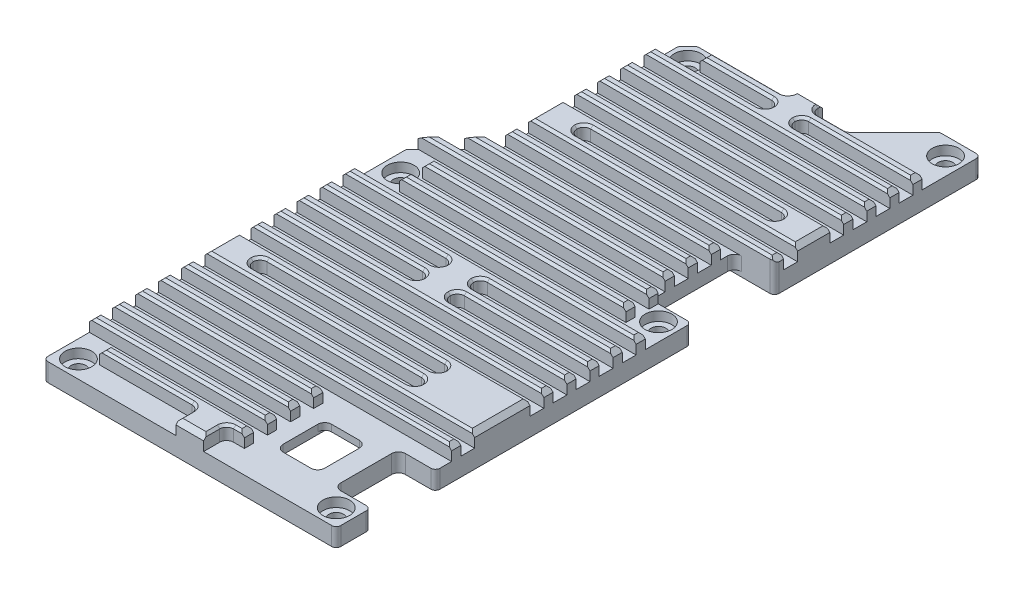
from build123d import *

# Parameters (mm, degrees)
BOSS_EXTRUDE1_DEPTH        = 6.95
CUT_EXTRUDE4_DEPTH         = 1
CUT_EXTRUDE5_DEPTH         = 2
CUT_EXTRUDE6_DEPTH         = 1.2
CUT_EXTRUDE7_DEPTH         = 2
CUT_EXTRUDE8_DEPTH         = 154.611986837
SKETCH15_W                 = 63.5
SKETCH15_H                 = 3
CUT_EXTRUDE9_DEPTH         = 3
LPATTERN1_COUNT            = 28
LPATTERN1_PITCH            = 5
SKETCH16_W                 = 19.671320344
SKETCH16_H                 = 10.16
SKETCH16_W_2               = 7.2
SKETCH16_H_2               = 7
SKETCH16_H_3               = 7.54
CUT_EXTRUDE10_DEPTH        = 3
F_3_2_3_2_DIAMETER_HOLE1_D = 3.2
SKETCH19_R                 = 2.9
CUT_EXTRUDE11_DEPTH        = 2
SKETCH20_W                 = 6
SKETCH20_H                 = 7
SKETCH20_W_2               = 5
SKETCH20_H_2               = 7.54
SKETCH20_W_3               = 7
SKETCH20_W_4               = 15
SKETCH20_H_3               = 12
SKETCH20_H_4               = 8
BOSS_EXTRUDE2_DEPTH        = 3
FILLET1_R                  = 1.5
CUT_EXTRUDE12_DEPTH        = 3
CUT_EXTRUDE13_DEPTH        = 2.5
CUT_EXTRUDE14_DEPTH        = 2.5
CUT_EXTRUDE15_DEPTH        = 3.5
BOSS_EXTRUDE3_DEPTH        = 0.5
CHAMFER1_SIZE              = 0.5
CHAMFER2_SIZE              = 1
CUT_EXTRUDE16_DEPTH        = 2
M3_TAPPED_HOLE1_D          = 2.5
M3_TAPPED_HOLE1_DEPTH      = 6
M3_TAPPED_HOLE1_TIP        = 0.751075774


with BuildPart() as part:
    # Sketch1 → Boss-Extrude1 (new body)
    with BuildSketch(Plane(origin=(0, 0, 0), x_dir=(1, 0, 0), z_dir=(0, 1, 0))):
        with BuildLine():
            Line((0, 1), (0, 78.325786438))
            ThreePointArc((0, 78.325786438), (0.076120467, 78.70846987), (0.292893219, 79.032893219))
            Line((0.292893219, 79.032893219), (9.720660172, 88.460660172))
            ThreePointArc((9.720660172, 88.460660172), (10.045819299, 88.947295195), (10.16, 89.521320344))
            Line((10.16, 89.521320344), (10.16, 127.095786438))
            ThreePointArc((10.16, 127.095786438), (10.236120467, 127.47846987), (10.452893219, 127.802893219))
            Line((10.452893219, 127.802893219), (11.897106781, 129.247106781))
            ThreePointArc((11.897106781, 129.247106781), (12.22153013, 129.463879533), (12.604213562, 129.54))
            Line((12.604213562, 129.54), (43.828679656, 129.54))
            ThreePointArc((43.828679656, 129.54), (44.402704805, 129.654180701), (44.889339828, 129.979339828))
            Line((44.889339828, 129.979339828), (54.317106781, 139.407106781))
            ThreePointArc((54.317106781, 139.407106781), (54.64153013, 139.623879533), (55.024213562, 139.7))
            Line((55.024213562, 139.7), (62.5, 139.7))
            ThreePointArc((62.5, 139.7), (63.207106781, 139.407106781), (63.5, 138.7))
            Line((63.5, 138.7), (63.5, 96))
            ThreePointArc((63.5, 96), (63.207106781, 95.292893219), (62.5, 95))
            Line((62.5, 95), (56.3, 95))
            ThreePointArc((56.3, 95), (55.239339828, 94.560660172), (54.8, 93.5))
            Line((54.8, 93.5), (54.8, 78.5))
            ThreePointArc((54.8, 78.5), (55.239339828, 77.439339828), (56.3, 77))
            Line((56.3, 77), (62.5, 77))
            ThreePointArc((62.5, 77), (63.207106781, 76.707106781), (63.5, 76))
            Line((63.5, 76), (63.5, 22.5))
            ThreePointArc((63.5, 22.5), (63.207106781, 21.792893219), (62.5, 21.5))
            Line((62.5, 21.5), (57, 21.5))
            ThreePointArc((57, 21.5), (55.939339828, 21.060660172), (55.5, 20))
            Line((55.5, 20), (55.5, 9))
            ThreePointArc((55.5, 9), (55.939339828, 7.939339828), (57, 7.5))
            Line((57, 7.5), (62.5, 7.5))
            ThreePointArc((62.5, 7.5), (63.207106781, 7.207106781), (63.5, 6.5))
            Line((63.5, 6.5), (63.5, 1))
            ThreePointArc((63.5, 1), (63.207106781, 0.292893219), (62.5, 0))
            Line((62.5, 0), (1, 0))
            ThreePointArc((1, 0), (0.292893219, 0.292893219), (0, 1))
        make_face()
    extrude(amount=BOSS_EXTRUDE1_DEPTH)

    # Sketch2 → Cut-Extrude4 (cut)
    with BuildSketch(Plane(origin=(0, 0, 0), x_dir=(1, 0, 0), z_dir=(0, 1, 0))):
        with BuildLine():
            Line((46.26, 113.15), (33.01, 113.15))
            ThreePointArc((33.01, 113.15), (31.949339828, 112.710660172), (31.51, 111.65))
            Line((31.51, 111.65), (31.51, 99.65))
            ThreePointArc((31.51, 99.65), (31.070660172, 98.589339828), (30.01, 98.15))
            Line((30.01, 98.15), (19.51, 98.15))
            ThreePointArc((19.51, 98.15), (18.449339828, 98.589339828), (18.01, 99.65))
            Line((18.01, 99.65), (18.01, 121.15))
            ThreePointArc((18.01, 121.15), (18.449339828, 122.210660172), (19.51, 122.65))
            Line((19.51, 122.65), (56.01, 122.65))
            ThreePointArc((56.01, 122.65), (57.070660172, 122.210660172), (57.51, 121.15))
            Line((57.51, 121.15), (57.51, 109.65))
            ThreePointArc((57.51, 109.65), (57.070660172, 108.589339828), (56.01, 108.15))
            Line((56.01, 108.15), (49.51, 108.15))
            ThreePointArc((49.51, 108.15), (48.449339828, 108.589339828), (48.01, 109.65))
            Line((48.01, 109.65), (48.01, 111.4))
            ThreePointArc((48.01, 111.4), (47.497436867, 112.637436867), (46.26, 113.15))
        make_face()
        with BuildLine():
            Line((43.76, 109.25), (39.26, 109.25))
            ThreePointArc((39.26, 109.25), (38.199339828, 108.810660172), (37.76, 107.75))
            Line((37.76, 107.75), (37.76, 94))
            ThreePointArc((37.76, 94), (37.320660172, 92.939339828), (36.26, 92.5))
            ThreePointArc((36.26, 92.5), (35.199339828, 92.060660172), (34.76, 91))
            Line((34.76, 91), (34.76, 71.5))
            ThreePointArc((34.76, 71.5), (35.199339828, 70.439339828), (36.26, 70))
            Line((36.26, 70), (53.76, 70))
            ThreePointArc((53.76, 70), (54.820660172, 70.439339828), (55.26, 71.5))
            Line((55.26, 71.5), (55.26, 75.5))
            ThreePointArc((55.26, 75.5), (55.699339828, 76.560660172), (56.76, 77))
            Line((56.76, 77), (62.5, 77))
            Line((62.5, 77), (62.5, 95))
            Line((62.5, 95), (46.76, 95))
            ThreePointArc((46.76, 95), (45.699339828, 95.439339828), (45.26, 96.5))
            Line((45.26, 96.5), (45.26, 107.75))
            ThreePointArc((45.26, 107.75), (44.820660172, 108.810660172), (43.76, 109.25))
        make_face()
        with BuildLine():
            ThreePointArc((23.76, 42.1), (22.345786438, 41.514213562), (21.76, 40.1))
            Line((21.76, 40.1), (21.76, 29.35))
            ThreePointArc((21.76, 29.35), (22.345786438, 27.935786438), (23.76, 27.35))
            Line((23.76, 27.35), (28.76, 27.35))
            ThreePointArc((28.76, 27.35), (30.174213562, 27.935786438), (30.76, 29.35))
            Line((30.76, 29.35), (30.76, 40.1))
            ThreePointArc((30.76, 40.1), (30.174213562, 41.514213562), (28.76, 42.1))
            Line((28.76, 42.1), (23.76, 42.1))
        make_face()
    extrude(amount=CUT_EXTRUDE4_DEPTH, mode=Mode.SUBTRACT)

    # Sketch11 → Cut-Extrude5 (cut)
    with BuildSketch(Plane(origin=(0, 0, 0), x_dir=(1, 0, 0), z_dir=(0, 1, 0))):
        with BuildLine():
            Line((18.76, 92.25), (30.26, 92.25))
            ThreePointArc((30.26, 92.25), (31.320660172, 91.810660172), (31.76, 90.75))
            Line((31.76, 90.75), (31.76, 68.495584412))
            ThreePointArc((31.76, 68.495584412), (31.622983159, 67.806754234), (31.232792206, 67.222792206))
            Line((31.232792206, 67.222792206), (28.787207794, 64.777207794))
            ThreePointArc((28.787207794, 64.777207794), (28.397016841, 64.193245766), (28.26, 63.504415588))
            Line((28.26, 63.504415588), (28.26, 53.495584412))
            ThreePointArc((28.26, 53.495584412), (28.122983159, 52.806754234), (27.732792206, 52.222792206))
            Line((27.732792206, 52.222792206), (20.537207794, 45.027207794))
            ThreePointArc((20.537207794, 45.027207794), (20.147016841, 44.443245766), (20.01, 43.754415588))
            Line((20.01, 43.754415588), (20.01, 26))
            ThreePointArc((20.01, 26), (20.449339828, 24.939339828), (21.51, 24.5))
            Line((21.51, 24.5), (49.76, 24.5))
            ThreePointArc((49.76, 24.5), (50.820660172, 24.060660172), (51.26, 23))
            Line((51.26, 23), (51.26, 6))
            ThreePointArc((51.26, 6), (50.820660172, 4.939339828), (49.76, 4.5))
            Line((49.76, 4.5), (43.26, 4.5))
            ThreePointArc((43.26, 4.5), (42.199339828, 4.939339828), (41.76, 6))
            Line((41.76, 6), (41.76, 6.74))
            ThreePointArc((41.76, 6.74), (41.537401154, 7.277401154), (41, 7.5))
            Line((41, 7.5), (19.505584412, 7.5))
            ThreePointArc((19.505584412, 7.5), (18.816754234, 7.637016841), (18.232792206, 8.027207794))
            Line((18.232792206, 8.027207794), (9.787207794, 16.472792206))
            ThreePointArc((9.787207794, 16.472792206), (9.397016841, 17.056754234), (9.26, 17.745584412))
            Line((9.26, 17.745584412), (9.26, 40.004415588))
            ThreePointArc((9.26, 40.004415588), (9.122983159, 40.693245766), (8.732792206, 41.277207794))
            Line((8.732792206, 41.277207794), (3.537207794, 46.472792206))
            ThreePointArc((3.537207794, 46.472792206), (3.147016841, 47.056754234), (3.01, 47.745584412))
            Line((3.01, 47.745584412), (3.01, 67.5))
            ThreePointArc((3.01, 67.5), (3.449339828, 68.560660172), (4.51, 69))
            Line((4.51, 69), (15.76, 69))
            ThreePointArc((15.76, 69), (16.820660172, 69.439339828), (17.26, 70.5))
            Line((17.26, 70.5), (17.26, 90.75))
            ThreePointArc((17.26, 90.75), (17.699339828, 91.810660172), (18.76, 92.25))
        make_face()
    extrude(amount=CUT_EXTRUDE5_DEPTH, mode=Mode.SUBTRACT)

    # Sketch12 → Cut-Extrude6 (cut)
    with BuildSketch(Plane.XZ):
        with BuildLine():
            Line((54.8, -42.1), (34.55, -42.1))
            ThreePointArc((34.55, -42.1), (33.135786438, -41.514213562), (32.55, -40.1))
            Line((32.55, -40.1), (32.55, -29.35))
            ThreePointArc((32.55, -29.35), (33.135786438, -27.935786438), (34.55, -27.35))
            Line((34.55, -27.35), (54.8, -27.35))
            ThreePointArc((54.8, -27.35), (56.214213562, -27.935786438), (56.8, -29.35))
            Line((56.8, -29.35), (56.8, -40.1))
            ThreePointArc((56.8, -40.1), (56.214213562, -41.514213562), (54.8, -42.1))
        make_face()
    extrude(amount=-CUT_EXTRUDE6_DEPTH, mode=Mode.SUBTRACT)

    # Sketch13 → Cut-Extrude7 (cut)
    with BuildSketch(Plane.XZ):
        with BuildLine():
            Line((36.8, -67), (55.3, -67))
            ThreePointArc((55.3, -67), (56.360660172, -66.560660172), (56.8, -65.5))
            Line((56.8, -65.5), (56.8, -46.5))
            ThreePointArc((56.8, -46.5), (56.360660172, -45.439339828), (55.3, -45))
            Line((55.3, -45), (34.05, -45))
            ThreePointArc((34.05, -45), (32.989339828, -45.439339828), (32.55, -46.5))
            Line((32.55, -46.5), (32.55, -50))
            ThreePointArc((32.55, -50), (32.989339828, -51.060660172), (34.05, -51.5))
            Line((34.05, -51.5), (34.5, -51.5))
            ThreePointArc((34.5, -51.5), (35.065685425, -51.734314575), (35.3, -52.3))
            Line((35.3, -52.3), (35.3, -65.5))
            ThreePointArc((35.3, -65.5), (35.739339828, -66.560660172), (36.8, -67))
        make_face()
    extrude(amount=-CUT_EXTRUDE7_DEPTH, mode=Mode.SUBTRACT)

    # Sketch14 → Cut-Extrude8 (cut, through all)
    with BuildSketch(Plane(origin=(0, 6.95, 0), x_dir=(1, 0, 0), z_dir=(0, 1, 0))):
        with BuildLine():
            Line((43.5, 19), (49.5, 19))
            ThreePointArc((49.5, 19), (50.560660172, 18.560660172), (51, 17.5))
            Line((51, 17.5), (51, 10))
            ThreePointArc((51, 10), (50.560660172, 8.939339828), (49.5, 8.5))
            Line((49.5, 8.5), (43.5, 8.5))
            ThreePointArc((43.5, 8.5), (42.439339828, 8.939339828), (42, 10))
            Line((42, 10), (42, 17.5))
            ThreePointArc((42, 17.5), (42.439339828, 18.560660172), (43.5, 19))
        make_face()
    extrude(amount=-CUT_EXTRUDE8_DEPTH, mode=Mode.SUBTRACT)

    # Sketch15 → Cut-Extrude9 (cut)
    with BuildSketch(Plane(origin=(0, 6.95, 0), x_dir=(1, 0, 0), z_dir=(0, 1, 0))):
        with Locations((31.75, 3.5)):
            Rectangle(SKETCH15_W, SKETCH15_H)
    cut_extrude9 = extrude(amount=-CUT_EXTRUDE9_DEPTH, mode=Mode.SUBTRACT)

    # LPattern1: Cut-Extrude9 ×28
    with Locations(*[(0, 0, -i * LPATTERN1_PITCH) for i in range(1, LPATTERN1_COUNT)]):
        add(cut_extrude9, mode=Mode.SUBTRACT)

    # Sketch16 → Cut-Extrude10 (cut)
    with BuildSketch(Plane(origin=(0, 6.95, 0), x_dir=(1, 0, 0), z_dir=(0, 1, 0))):
        Polygon((38.6, 22), (38.6, 2), (7.2, 2), (7.2, 10), (0, 10), (0, 0), (63.5, 0), (63.5, 20), (63.5, 22), align=None)
        with Locations((53.664339828, 134.62)):
            Rectangle(SKETCH16_W, SKETCH16_H)
        with Locations((59.9, 73.5)):
            Rectangle(SKETCH16_W_2, SKETCH16_H_2)
        with Locations((3.6, 73.5)):
            Rectangle(SKETCH16_W_2, SKETCH16_H_2)
        with Locations((13.76, 125.77)):
            Rectangle(SKETCH16_W_2, SKETCH16_H_3)
    extrude(amount=-CUT_EXTRUDE10_DEPTH, mode=Mode.SUBTRACT)

    # Ø3.2 (3.2) Diameter Hole1 (through all)
    with Locations(Plane(origin=(0, 3.95, 0), x_dir=(1, 0, 0), z_dir=(0, 1, 0))):
        with Locations((59.69, 3.81), (3.81, 3.81), (3.81, 73.66), (59.69, 73.66), (13.97, 125.73), (59.69, 135.89)):
            Hole(F_3_2_3_2_DIAMETER_HOLE1_D / 2)

    # Sketch19 → Cut-Extrude11 (cut)
    with BuildSketch(Plane(origin=(0, 3.95, 0), x_dir=(1, 0, 0), z_dir=(0, 1, 0))):
        with Locations(Location((3.81, 3.81, 0), (0, 0, 270))):
            Circle(SKETCH19_R)
        with Locations(Location((59.69, 3.81, 0), (0, 0, 270))):
            Circle(SKETCH19_R)
        with Locations(Location((3.81, 73.66, 0), (0, 0, 270))):
            Circle(SKETCH19_R)
        with Locations(Location((59.69, 73.66, 0), (0, 0, 270))):
            Circle(SKETCH19_R)
        with Locations(Location((13.97, 125.73, 0), (0, 0, 270))):
            Circle(SKETCH19_R)
        with Locations(Location((59.69, 135.89, 0), (0, 0, 270))):
            Circle(SKETCH19_R)
    extrude(amount=-CUT_EXTRUDE11_DEPTH, mode=Mode.SUBTRACT)

    # Sketch20 → Boss-Extrude2 (add)
    with BuildSketch(Plane(origin=(0, 3.95, 0), x_dir=(1, 0, 0), z_dir=(0, 1, 0))):
        with Locations((31.75, 3.5)):
            Rectangle(SKETCH20_W, SKETCH20_H)
        with Locations((36.91, 125.77)):
            Rectangle(SKETCH20_W_2, SKETCH20_H_2)
        with Locations((3.5, 38.5)):
            Rectangle(SKETCH20_W_3, SKETCH20_H)
        with Locations((56, 36)):
            Rectangle(SKETCH20_W_4, SKETCH20_H_3)
        with Locations((31.75, 56)):
            Rectangle(SKETCH20_W, SKETCH20_H_4)
        with Locations((13.66, 98.5)):
            Rectangle(SKETCH20_W_3, SKETCH20_H)
        with Locations((60, 103.5)):
            Rectangle(SKETCH20_W_3, SKETCH20_H)
    extrude(amount=BOSS_EXTRUDE2_DEPTH)

    # Fillet1
    fillet1_edges = [part.edges().sort_by_distance(p)[0] for p in [
        (39.41, 5.45, -122),
        (39.41, 5.45, -125),
        (39.41, 5.45, -127),
        (34.41, 5.45, -127),
        (34.41, 5.45, -122),
        (34.41, 5.45, -125),
        (56.5, 5.45, -102),
        (56.5, 5.45, -105),
        (17.16, 5.45, -97),
        (17.16, 5.45, -100),
        (28.75, 5.45, -52),
        (28.75, 5.45, -55),
        (28.75, 5.45, -57),
        (28.75, 5.45, -60),
        (34.75, 5.45, -60),
        (34.75, 5.45, -57),
        (34.75, 5.45, -52),
        (34.75, 5.45, -55),
        (7, 5.45, -37),
        (7, 5.45, -40),
        (34.75, 5.45, -5),
        (28.75, 5.45, -5),
        (48.5, 5.45, -37),
        (48.5, 5.45, -40),
        (48.5, 5.45, -32),
        (48.5, 5.45, -35),
    ]]
    fillet(fillet1_edges, radius=FILLET1_R - 0.0001)  # a hair under: the kernel refuses the full size

    # Sketch21 → Cut-Extrude12 (cut)
    with BuildSketch(Plane.XZ):
        with BuildLine():
            Line((55.26, -76), (55.26, -71.5))
            ThreePointArc((55.26, -71.5), (54.820660172, -70.439339828), (53.76, -70))
            Line((53.76, -70), (42.76, -70))
            ThreePointArc((42.76, -70), (41.699339828, -70.439339828), (41.26, -71.5))
            Line((41.26, -71.5), (41.26, -76))
            ThreePointArc((41.26, -76), (41.699339828, -77.060660172), (42.76, -77.5))
            Line((42.76, -77.5), (53.76, -77.5))
            ThreePointArc((53.76, -77.5), (54.820660172, -77.060660172), (55.26, -76))
        make_face()
        with BuildLine():
            ThreePointArc((43.76, -109.25), (44.820660172, -108.810660172), (45.26, -107.75))
            Line((45.26, -107.75), (45.26, -94))
            ThreePointArc((45.26, -94), (44.820660172, -92.939339828), (43.76, -92.5))
            Line((43.76, -92.5), (39.26, -92.5))
            ThreePointArc((39.26, -92.5), (38.199339828, -92.939339828), (37.76, -94))
            Line((37.76, -94), (37.76, -107.75))
            ThreePointArc((37.76, -107.75), (38.199339828, -108.810660172), (39.26, -109.25))
            Line((39.26, -109.25), (43.76, -109.25))
        make_face()
    extrude(amount=-CUT_EXTRUDE12_DEPTH, mode=Mode.SUBTRACT)

    # Sketch22 → Cut-Extrude13 (cut)
    with BuildSketch(Plane.XZ):
        with BuildLine():
            Line((49.76, -24.5), (43.5, -24.5))
            ThreePointArc((43.5, -24.5), (42.439339828, -24.060660172), (42, -23))
            Line((42, -23), (42, -16.844037914))
            Line((42, -16.844037914), (49.76, -16.844037914))
            ThreePointArc((49.76, -16.844037914), (50.820660172, -17.283377742), (51.26, -18.344037914))
            Line((51.26, -18.344037914), (51.26, -23))
            ThreePointArc((51.26, -23), (50.820660172, -24.060660172), (49.76, -24.5))
        make_face()
        with BuildLine():
            Line((37.55, -35.45), (34.05, -35.45))
            ThreePointArc((34.05, -35.45), (32.989339828, -35.010660172), (32.55, -33.95))
            Line((32.55, -33.95), (32.55, -30.95))
            ThreePointArc((32.55, -30.95), (32.989339828, -29.889339828), (34.05, -29.45))
            Line((34.05, -29.45), (37.55, -29.45))
            ThreePointArc((37.55, -29.45), (38.610660172, -29.889339828), (39.05, -30.95))
            Line((39.05, -30.95), (39.05, -33.95))
            ThreePointArc((39.05, -33.95), (38.610660172, -35.010660172), (37.55, -35.45))
        make_face()
    extrude(amount=-CUT_EXTRUDE13_DEPTH, mode=Mode.SUBTRACT)

    # Sketch25 → Cut-Extrude14 (cut)
    with BuildSketch(Plane.XZ):
        with BuildLine():
            Line((30.01, -122.65), (19.51, -122.65))
            ThreePointArc((19.51, -122.65), (18.449339828, -122.210660172), (18.01, -121.15))
            Line((18.01, -121.15), (18.01, -99.65))
            ThreePointArc((18.01, -99.65), (18.449339828, -98.589339828), (19.51, -98.15))
            Line((19.51, -98.15), (30.01, -98.15))
            ThreePointArc((30.01, -98.15), (31.070660172, -98.589339828), (31.51, -99.65))
            Line((31.51, -99.65), (31.51, -121.15))
            ThreePointArc((31.51, -121.15), (31.070660172, -122.210660172), (30.01, -122.65))
        make_face()
        with BuildLine():
            Line((10.71, -57.3), (7.71, -57.3))
            ThreePointArc((7.71, -57.3), (6.649339828, -56.860660172), (6.21, -55.8))
            Line((6.21, -55.8), (6.21, -52.8))
            ThreePointArc((6.21, -52.8), (6.649339828, -51.739339828), (7.71, -51.3))
            Line((7.71, -51.3), (10.71, -51.3))
            ThreePointArc((10.71, -51.3), (11.770660172, -51.739339828), (12.21, -52.8))
            Line((12.21, -52.8), (12.21, -55.8))
            ThreePointArc((12.21, -55.8), (11.770660172, -56.860660172), (10.71, -57.3))
        make_face()
    extrude(amount=-CUT_EXTRUDE14_DEPTH, mode=Mode.SUBTRACT)

    # Sketch26 → Cut-Extrude15 (cut)
    with BuildSketch(Plane.XZ):
        with BuildLine():
            ThreePointArc((52.2, -37.65), (51.139339828, -37.210660172), (50.7, -36.15))
            Line((50.7, -36.15), (50.7, -33.15))
            ThreePointArc((50.7, -33.15), (51.139339828, -32.089339828), (52.2, -31.65))
            Line((52.2, -31.65), (55.3, -31.65))
            ThreePointArc((55.3, -31.65), (56.360660172, -32.089339828), (56.8, -33.15))
            Line((56.8, -33.15), (56.8, -36.15))
            ThreePointArc((56.8, -36.15), (56.360660172, -37.210660172), (55.3, -37.65))
            Line((55.3, -37.65), (52.2, -37.65))
        make_face()
    extrude(amount=-CUT_EXTRUDE15_DEPTH, mode=Mode.SUBTRACT)

    # Sketch27 → Boss-Extrude3 (add)
    with BuildSketch(Plane.XZ.offset(-2)):
        with BuildLine():
            Line((34.86, -17.2), (29.86, -17.2))
            ThreePointArc((29.86, -17.2), (29.506446609, -17.053553391), (29.36, -16.7))
            Line((29.36, -16.7), (29.36, -11.7))
            ThreePointArc((29.36, -11.7), (29.506446609, -11.346446609), (29.86, -11.2))
            Line((29.86, -11.2), (34.86, -11.2))
            ThreePointArc((34.86, -11.2), (35.213553391, -11.346446609), (35.36, -11.7))
            Line((35.36, -11.7), (35.36, -16.7))
            ThreePointArc((35.36, -16.7), (35.213553391, -17.053553391), (34.86, -17.2))
        make_face()
    extrude(amount=BOSS_EXTRUDE3_DEPTH)

    # Chamfer1
    chamfer1_edges = [part.edges().sort_by_distance(p)[0] for p in [
        (34.41, 6.95, -129.01995),
        (33.970689461, 6.95, -127.439310539),
        (25.13505, 6.95, -127),
        (39.41, 6.95, -129.01995),
        (39.849310539, 6.95, -127.439310539),
        (52.20495, 6.95, -127),
        (52.20495, 6.95, -125),
        (39.849310539, 6.95, -124.560689461),
        (39.849310539, 6.95, -122.439310539),
        (52.20495, 6.95, -122),
        (25.13505, 6.95, -125),
        (33.970689461, 6.95, -124.560689461),
        (33.970689461, 6.95, -122.439310539),
        (21.53505, 6.95, -122),
        (36.83, 6.95, -120),
        (36.83, 6.95, -117),
        (36.83, 6.95, -115),
        (36.83, 6.95, -112),
        (36.83, 6.95, -110),
        (36.83, 6.95, -107),
        (32.58005, 6.95, -105),
        (56.060689461, 6.95, -104.560689461),
        (56.060689461, 6.95, -102.439310539),
        (32.58005, 6.95, -102),
        (41.07995, 6.95, -100),
        (17.599310539, 6.95, -99.560689461),
        (17.599310539, 6.95, -97.439310539),
        (41.07995, 6.95, -97),
        (63.5, 6.95, -96.5),
        (63.207106781, 6.95, -95.292893219),
        (36.33, 6.95, -95),
        (32.48, 6.95, -92),
        (32.48, 6.95, -90),
        (31.53, 6.95, -87),
        (30.53, 6.95, -85),
        (29.03, 6.95, -82),
        (28.03, 6.95, -80),
        (31.75, 6.95, -77),
        (31.75, 6.95, -75),
        (49.87495, 6.95, -52),
        (35.189310539, 6.95, -52.439310539),
        (35.189310539, 6.95, -54.560689461),
        (49.87495, 6.95, -55),
        (49.87495, 6.95, -57),
        (35.189310539, 6.95, -57.439310539),
        (35.189310539, 6.95, -59.560689461),
        (49.87495, 6.95, -60),
        (31.75, 6.95, -72),
        (31.75, 6.95, -70),
        (31.75, 6.95, -67),
        (31.75, 6.95, -65),
        (31.75, 6.95, -62),
        (13.62505, 6.95, -57),
        (28.310689461, 6.95, -57.439310539),
        (28.310689461, 6.95, -59.560689461),
        (13.62505, 6.95, -60),
        (13.62505, 6.95, -55),
        (28.310689461, 6.95, -54.560689461),
        (28.310689461, 6.95, -52.439310539),
        (13.62505, 6.95, -52),
        (31.75, 6.95, -50),
        (31.75, 6.95, -47),
        (31.75, 6.95, -45),
        (31.75, 6.95, -42),
        (27.75, 6.95, -40),
        (7.439310539, 6.95, -39.560689461),
        (48.060689461, 6.95, -39.560689461),
        (7.439310539, 6.95, -37.439310539),
        (48.060689461, 6.95, -37.439310539),
        (27.75, 6.95, -37),
        (23.50005, 6.95, -35),
        (48.060689461, 6.95, -34.560689461),
        (48.060689461, 6.95, -32.439310539),
        (23.50005, 6.95, -32),
        (31.75, 6.95, -30),
        (31.75, 6.95, -27),
        (31.75, 6.95, -25),
        (19.3, 6.95, -22),
        (19.3, 6.95, -20),
        (19.3, 6.95, -17),
        (19.3, 6.95, -15),
        (19.3, 6.95, -12),
        (19.3, 6.95, -10),
        (22.9, 6.95, -7),
        (34.75, 6.95, -1.75005),
        (35.189310539, 6.95, -4.560689461),
        (37.42495, 6.95, -5),
        (28.75, 6.95, -1.75005),
        (28.310689461, 6.95, -4.560689461),
        (17.22505, 6.95, -5),
    ]]
    chamfer(chamfer1_edges, length=CHAMFER1_SIZE)

    # Chamfer2
    chamfer2_edges = [part.edges().sort_by_distance(p)[0] for p in [
        (38.6, 6.95, -6),
        (38.6, 6.95, -11),
        (38.6, 6.95, -16),
        (38.6, 6.95, -21),
        (63.5, 6.95, -26),
        (63.5, 6.95, -36),
        (63.5, 6.95, -46),
        (63.5, 6.95, -51),
        (63.5, 6.95, -56),
        (63.5, 6.95, -61),
        (63.5, 6.95, -66),
        (56.3, 6.95, -71),
        (56.3, 6.95, -76),
        (54.8, 6.95, -81),
        (54.8, 6.95, -86),
        (54.8, 6.95, -91),
        (63.5, 6.95, -103.5),
        (63.5, 6.95, -111),
        (63.5, 6.95, -116),
        (63.5, 6.95, -121),
        (63.5, 6.95, -126),
        (36.91, 6.95, -129.54),
        (17.36, 6.95, -126),
        (10.16, 6.95, -121),
        (10.16, 6.95, -116),
        (10.16, 6.95, -111),
        (10.16, 6.95, -106),
        (10.16, 6.95, -98.5),
        (10.16, 6.95, -91),
        (7.26, 6.95, -86),
        (2.26, 6.95, -81),
        (7.2, 6.95, -76),
        (7.2, 6.95, -71),
        (0, 6.95, -66),
        (0, 6.95, -61),
        (0, 6.95, -56),
        (0, 6.95, -51),
        (0, 6.95, -46),
        (0, 6.95, -38.5),
        (0, 6.95, -31),
        (0, 6.95, -26),
        (31.75, 6.95, 0),
        (0, 6.95, -21),
        (0, 6.95, -16),
        (0, 6.95, -11),
        (7.2, 6.95, -6),
    ]]
    chamfer(chamfer2_edges, length=CHAMFER2_SIZE)

    # Sketch28 → Cut-Extrude16 (cut)
    with BuildSketch(Plane(origin=(0, 0, -97), x_dir=(-1, 0, 0), z_dir=(0, 0, -1))):
        Polygon((-63.5, 5.95), (-62.5, 6.95), (-63.5, 6.95), align=None)
    extrude(amount=-CUT_EXTRUDE16_DEPTH, mode=Mode.SUBTRACT)

    # M3 Tapped Hole1
    with Locations(Plane(origin=(0, 0, 0), x_dir=(-1, 0, 0), z_dir=(0, -1, 0))):
        with Locations((-31.75, 3.81), (-3.81, 38.74), (-59.69, 38.74), (-31.75, 56), (-36.83, 125.73), (-59.69, 104.77), (-13.97, 99.69)):
            Hole(M3_TAPPED_HOLE1_D / 2, depth=M3_TAPPED_HOLE1_DEPTH)
            with Locations((0, 0, -(M3_TAPPED_HOLE1_DEPTH + M3_TAPPED_HOLE1_TIP / 2))):  # 118° drill point
                Cone(0, M3_TAPPED_HOLE1_D / 2, M3_TAPPED_HOLE1_TIP, mode=Mode.SUBTRACT)


solid = part.part
